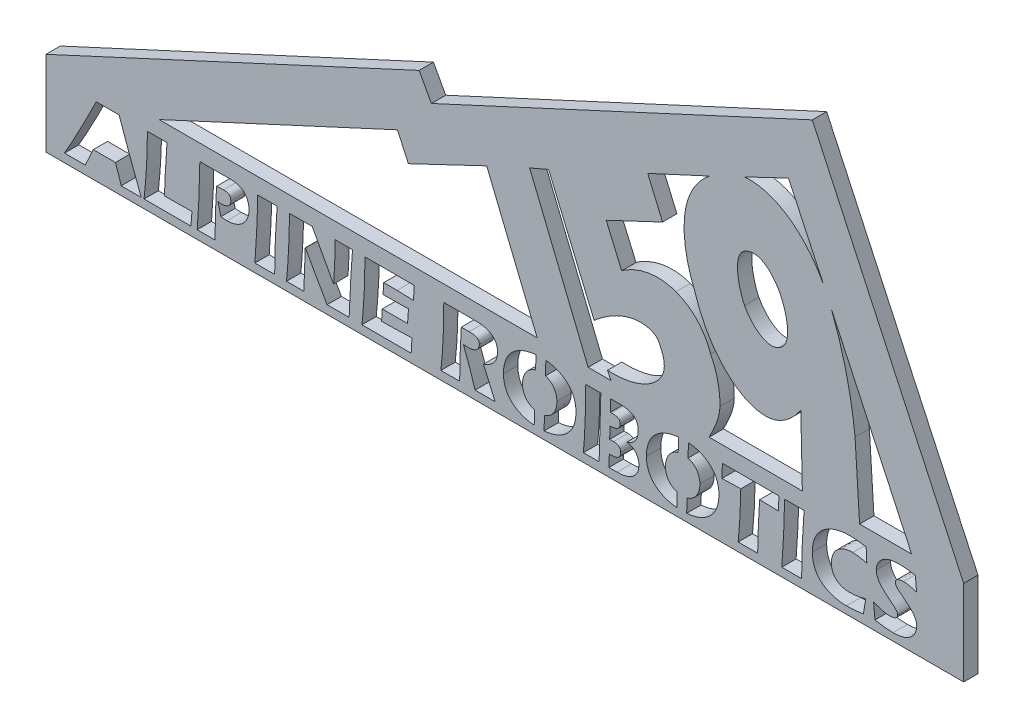
from build123d import *

# Parameters (mm, degrees)
BOSS_EXTRUDE1_DEPTH = 6.35


with BuildPart() as part:
    # Sketch3 → Boss-Extrude1 (new body)
    with BuildSketch(Plane.XY):
        Polygon((26.514269607, 145.890894888), (432.914269607, 145.890894888), (432.914269607, 183.703654156), (365.88058471, 327.965682502), (197.195058392, 249.908741462), (191.754304663, 259.874339463), (26.514269607, 183.43107077), align=None)
        with BuildLine():
            Line((48.791040319, 176.357545223), (58.878222756, 176.357545223))
            add(Edge.make_bspline(
                [(68.685368354, 149.635855201), (65.282867539, 158.489491339), (61.960225137, 167.383589074), (58.878222756, 176.357545223)],
                knots=[0, 0, 0, 0, 1, 1, 1, 1], degree=3))
            Line((68.685368354, 149.635855201), (59.798724072, 149.635855201))
            add(Edge.make_bspline(
                [(57.276795365, 157.327817614), (58.19782907, 154.763830143), (59.118330386, 152.240304268), (59.798724072, 149.635855201)],
                knots=[0, 0, 0, 0, 1, 1, 1, 1], degree=3))
            Line((57.276795365, 157.327817614), (47.429720559, 157.327817614))
            Line((47.429720559, 157.327817614), (43.907432123, 149.635855201))
            Line((43.907432123, 149.635855201), (34.700821796, 149.635855201))
            add(Edge.make_bspline(
                [(48.791040319, 176.357545223), (46.589077657, 171.670388725), (37.542716547, 154.323011699), (34.700821796, 149.635855201)],
                knots=[0, 0, 0, 0, 1, 1, 1, 1], degree=3))
        make_face(mode=Mode.SUBTRACT)
        with BuildLine():
            Line((91.147410587, 155.484685424), (90.707124532, 149.635855201))
            Line((90.707124532, 149.635855201), (69.932224388, 149.635855201))
            add(Edge.make_bspline(
                [(71.453260975, 176.357545223), (71.372870172, 167.424050671), (70.932584118, 158.489491339), (69.932224388, 149.635855201)],
                knots=[0, 0, 0, 0, 1, 1, 1, 1], degree=3))
            Line((71.453260975, 176.357545223), (80.099265238, 176.357545223))
            add(Edge.make_bspline(
                [(78.978585498, 155.364365414), (79.098905508, 161.655078861), (79.899086814, 173.673237742), (80.099265238, 176.357545223)],
                knots=[0, 0, 0, 0, 1, 1, 1, 1], degree=3))
            Line((78.978585498, 155.364365414), (83.461836847, 155.364365414))
            add(Edge.make_bspline(
                [(91.147410587, 155.484685424), (88.585552673, 155.364365414), (86.02369476, 155.364365414), (83.461836847, 155.364365414)],
                knots=[0, 0, 0, 0, 1, 1, 1, 1], degree=3))
        make_face(mode=Mode.SUBTRACT)
        with BuildLine():
            Line((94.634561321, 176.357545223), (108.804638258, 176.357545223))
            add(Edge.make_bspline(
                [(116.410353584, 168.745441223), (116.410353584, 171.189108684), (115.369532258, 176.357545223), (108.804638258, 176.357545223)],
                knots=[0, 0, 0, 0, 1, 1, 1, 1], degree=3))
            add(Edge.make_bspline(
                [(106.643137192, 159.651165065), (112.087351453, 159.651165065), (116.410353584, 163.056327827), (116.410353584, 168.745441223)],
                knots=[0, 0, 0, 0, 1, 1, 1, 1], degree=3))
            add(Edge.make_bspline(
                [(103.961491658, 159.891805085), (104.842063767, 159.732088257), (105.722635876, 159.651165065), (106.643137192, 159.651165065)],
                knots=[0, 0, 0, 0, 1, 1, 1, 1], degree=3))
            Line((103.961491658, 159.891805085), (102.680562701, 165.060241623))
            add(Edge.make_bspline(
                [(104.321386909, 164.899460017), (103.761313234, 164.899460017), (103.20070717, 164.979318431), (102.680562701, 165.060241623)],
                knots=[0, 0, 0, 0, 1, 1, 1, 1], degree=3))
            add(Edge.make_bspline(
                [(108.364352203, 168.184302769), (108.364352203, 165.781096905), (106.482887975, 164.899460017), (104.321386909, 164.899460017)],
                knots=[0, 0, 0, 0, 1, 1, 1, 1], degree=3))
            add(Edge.make_bspline(
                [(105.122100605, 170.748290241), (106.963635626, 170.748290241), (108.364352203, 170.347933393), (108.364352203, 168.184302769)],
                knots=[0, 0, 0, 0, 1, 1, 1, 1], degree=3))
            add(Edge.make_bspline(
                [(102.040098223, 170.588573413), (103.080919549, 170.668431827), (104.081279279, 170.748290241), (105.122100605, 170.748290241)],
                knots=[0, 0, 0, 0, 1, 1, 1, 1], degree=3))
            add(Edge.make_bspline(
                [(101.399633745, 149.635855201), (101.399633745, 159.651165065), (101.719599789, 164.458641573), (102.040098223, 170.588573413)],
                knots=[0, 0, 0, 0, 1, 1, 1, 1], degree=3))
            Line((101.399633745, 149.635855201), (93.473952374, 149.635855201))
            add(Edge.make_bspline(
                [(94.634561321, 176.357545223), (94.634561321, 168.66558281), (93.914238429, 153.682014831), (93.473952374, 149.635855201)],
                knots=[0, 0, 0, 0, 1, 1, 1, 1], degree=3))
        make_face(mode=Mode.SUBTRACT)
        with BuildLine():
            Line((120.177541156, 176.357545223), (128.864007015, 176.357545223))
            add(Edge.make_bspline(
                [(127.783256482, 149.635855201), (127.823185689, 158.529952936), (128.143151733, 167.463447488), (128.864007015, 176.357545223)],
                knots=[0, 0, 0, 0, 1, 1, 1, 1], degree=3))
            Line((127.783256482, 149.635855201), (119.016932209, 149.635855201))
            add(Edge.make_bspline(
                [(120.177541156, 176.357545223), (120.177541156, 165.460598471), (119.537076677, 157.527996038), (119.016932209, 149.635855201)],
                knots=[0, 0, 0, 0, 1, 1, 1, 1], degree=3))
        make_face(mode=Mode.SUBTRACT)
        with BuildLine():
            Line((154.605035716, 176.357545223), (162.25014786, 176.357545223))
            add(Edge.make_bspline(
                [(160.769572868, 149.635855201), (160.889360489, 156.64635915), (162.010040229, 173.632776145), (162.25014786, 176.357545223)],
                knots=[0, 0, 0, 0, 1, 1, 1, 1], degree=3))
            Line((160.769572868, 149.635855201), (151.002356477, 149.635855201))
            add(Edge.make_bspline(
                [(141.395389302, 166.622272196), (144.237284052, 160.973620397), (147.919821705, 155.445288607), (151.002356477, 149.635855201)],
                knots=[0, 0, 0, 0, 1, 1, 1, 1], degree=3))
            Line((141.395389302, 166.622272196), (141.314998498, 166.622272196))
            add(Edge.make_bspline(
                [(140.714995616, 149.635855201), (140.714995616, 153.641553235), (141.195210878, 164.219066332), (141.314998498, 166.622272196)],
                knots=[0, 0, 0, 0, 1, 1, 1, 1], degree=3))
            Line((140.714995616, 149.635855201), (133.029421876, 149.635855201))
            add(Edge.make_bspline(
                [(134.390209247, 176.357545223), (134.390209247, 168.66558281), (133.549566345, 153.882193255), (133.029421876, 149.635855201)],
                knots=[0, 0, 0, 0, 1, 1, 1, 1], degree=3))
            Line((134.390209247, 176.357545223), (144.397533269, 176.357545223))
            Line((144.397533269, 176.357545223), (153.844251227, 159.050629793))
            Line((153.844251227, 159.050629793), (153.924109641, 159.050629793))
            add(Edge.make_bspline(
                [(154.605035716, 176.357545223), (154.605035716, 171.670388725), (154.124288065, 161.614617264), (153.924109641, 159.050629793)],
                knots=[0, 0, 0, 0, 1, 1, 1, 1], degree=3))
        make_face(mode=Mode.SUBTRACT)
        with BuildLine():
            Line((167.781141596, 176.357545223), (189.55693386, 176.357545223))
            Line((189.55693386, 176.357545223), (189.276897022, 170.388394989))
            add(Edge.make_bspline(
                [(181.99168013, 170.629035009), (184.393288826, 170.629035009), (186.834826729, 170.508714999), (189.276897022, 170.388394989)],
                knots=[0, 0, 0, 0, 1, 1, 1, 1], degree=3))
            Line((181.99168013, 170.629035009), (176.067250608, 170.629035009))
            Line((176.067250608, 170.629035009), (175.786681381, 165.940813732))
            Line((175.786681381, 165.940813732), (180.350323532, 165.940813732))
            add(Edge.make_bspline(
                [(187.035005153, 166.061133742), (184.793645674, 165.981275329), (182.591683012, 165.940813732), (180.350323532, 165.940813732)],
                knots=[0, 0, 0, 0, 1, 1, 1, 1], degree=3))
            Line((187.035005153, 166.061133742), (186.634648306, 160.212303519))
            Line((186.634648306, 160.212303519), (175.426786129, 160.212303519))
            Line((175.426786129, 160.212303519), (175.146216902, 155.364365414))
            Line((175.146216902, 155.364365414), (177.788465619, 155.364365414))
            add(Edge.make_bspline(
                [(188.595970947, 155.684863848), (184.993824098, 155.484685424), (181.391144858, 155.364365414), (177.788465619, 155.364365414)],
                knots=[0, 0, 0, 0, 1, 1, 1, 1], degree=3))
            Line((188.595970947, 155.684863848), (188.236075696, 149.635855201))
            Line((188.236075696, 149.635855201), (166.420354226, 149.635855201))
            add(Edge.make_bspline(
                [(167.781141596, 176.357545223), (167.781141596, 163.457749454), (166.900569487, 154.042974861), (166.420354226, 149.635855201)],
                knots=[0, 0, 0, 0, 1, 1, 1, 1], degree=3))
        make_face(mode=Mode.SUBTRACT)
        with BuildLine():
            Line((202.679800798, 176.357545223), (216.851474903, 176.357545223))
            add(Edge.make_bspline(
                [(226.486126328, 169.266118081), (226.486126328, 176.157366799), (218.778192232, 176.357545223), (216.851474903, 176.357545223)],
                knots=[0, 0, 0, 0, 1, 1, 1, 1], degree=3))
            add(Edge.make_bspline(
                [(220.223629521, 161.453835658), (223.997205766, 162.77629099), (226.486126328, 165.060241623), (226.486126328, 169.266118081)],
                knots=[0, 0, 0, 0, 1, 1, 1, 1], degree=3))
            add(Edge.make_bspline(
                [(225.442643055, 149.635855201), (223.756565746, 153.602156417), (221.78938682, 157.448137624), (220.223629521, 161.453835658)],
                knots=[0, 0, 0, 0, 1, 1, 1, 1], degree=3))
            Line((225.442643055, 149.635855201), (216.52991169, 149.635855201))
            add(Edge.make_bspline(
                [(211.351359753, 164.619423179), (213.198218668, 159.651165065), (215.085006791, 154.723368547), (216.52991169, 149.635855201)],
                knots=[0, 0, 0, 0, 1, 1, 1, 1], degree=3))
            add(Edge.make_bspline(
                [(213.318538678, 164.419244756), (212.675944642, 164.419244756), (211.993421399, 164.499103169), (211.351359753, 164.619423179)],
                knots=[0, 0, 0, 0, 1, 1, 1, 1], degree=3))
            add(Edge.make_bspline(
                [(218.416699813, 168.065047538), (218.416699813, 165.299816865), (215.646677634, 164.419244756), (213.318538678, 164.419244756)],
                knots=[0, 0, 0, 0, 1, 1, 1, 1], degree=3))
            add(Edge.make_bspline(
                [(213.880741911, 170.748290241), (215.727068437, 170.748290241), (218.416699813, 170.748290241), (218.416699813, 168.065047538)],
                knots=[0, 0, 0, 0, 1, 1, 1, 1], degree=3))
            Line((213.880741911, 170.748290241), (210.42819649, 170.748290241))
            add(Edge.make_bspline(
                [(209.705211651, 149.635855201), (209.785602454, 156.686820746), (209.986313267, 163.737786291), (210.42819649, 170.748290241)],
                knots=[0, 0, 0, 0, 1, 1, 1, 1], degree=3))
            Line((209.705211651, 149.635855201), (201.395145115, 149.635855201))
            add(Edge.make_bspline(
                [(202.679800798, 176.357545223), (202.639871591, 165.660776895), (202.318840767, 157.928352885), (201.395145115, 149.635855201)],
                knots=[0, 0, 0, 0, 1, 1, 1, 1], degree=3))
        make_face(mode=Mode.SUBTRACT)
        Polygon((221.673059731, 238.220331281), (244.068486736, 183.43107077), (227.52814553, 183.43107077), (204.565723787, 183.43107077), (76.560605827, 183.43107077), (182.148468815, 232.278000164), (186.996816999, 221.713507692), align=None, mode=Mode.SUBTRACT)
        with BuildLine():
            Line((243.507681026, 176.724627731), (243.336517826, 170.716280326))
            add(Edge.make_bspline(
                [(237.529480172, 162.496254152), (237.529480172, 166.487444574), (239.710613098, 169.784066443), (243.336517826, 170.716280326)],
                knots=[0, 0, 0, 0, 1, 1, 1, 1], degree=3))
            add(Edge.make_bspline(
                [(242.896631063, 155.273326823), (239.65610973, 156.106116981), (237.529480172, 158.84386305), (237.529480172, 162.496254152)],
                knots=[0, 0, 0, 0, 1, 1, 1, 1], degree=3))
            Line((242.896631063, 155.273326823), (242.725334766, 149.258258001))
            add(Edge.make_bspline(
                [(229.098561237, 162.215152536), (229.098561237, 153.885853432), (235.378626895, 149.898056993), (242.725334766, 149.258258001)],
                knots=[0, 0, 0, 0, 1, 1, 1, 1], degree=3))
            add(Edge.make_bspline(
                [(243.507681026, 176.724627731), (236.383844678, 176.074180951), (229.098561237, 172.213159744), (229.098561237, 162.215152536)],
                knots=[0, 0, 0, 0, 1, 1, 1, 1], degree=3))
        make_face(mode=Mode.SUBTRACT)
        with BuildLine():
            Line((247.698317836, 170.683937669), (247.870479267, 176.727822068))
            add(Edge.make_bspline(
                [(261.214420913, 163.617466281), (261.214420913, 171.773472627), (255.155296867, 176.043502011), (247.870479267, 176.727822068)],
                knots=[0, 0, 0, 0, 1, 1, 1, 1], degree=3))
            add(Edge.make_bspline(
                [(247.088199555, 149.263914639), (255.128211555, 149.98277346), (261.214420913, 154.687166066), (261.214420913, 163.617466281)],
                knots=[0, 0, 0, 0, 1, 1, 1, 1], degree=3))
            Line((247.088199555, 149.263914639), (247.260560632, 155.3147201))
            add(Edge.make_bspline(
                [(252.784566757, 163.417287858), (252.784566757, 159.605512672), (250.73693048, 156.304897882), (247.260560632, 155.3147201)],
                knots=[0, 0, 0, 0, 1, 1, 1, 1], degree=3))
            add(Edge.make_bspline(
                [(247.698317836, 170.683937669), (250.836154559, 169.785197771), (252.784566757, 166.9669278), (252.784566757, 163.417287858)],
                knots=[0, 0, 0, 0, 1, 1, 1, 1], degree=3))
        make_face(mode=Mode.SUBTRACT)
        with BuildLine():
            Line((272.230889091, 176.357545223), (271.46977186, 149.635855201))
            Line((271.46977186, 149.635855201), (264.470514637, 149.635855201))
            add(Edge.make_bspline(
                [(265.554459506, 176.357545223), (265.594921103, 168.66558281), (265.073179466, 153.922654851), (264.470514637, 149.635855201)],
                knots=[0, 0, 0, 0, 1, 1, 1, 1], degree=3))
            Line((265.554459506, 176.357545223), (272.230889091, 176.357545223))
        make_face(mode=Mode.SUBTRACT)
        with BuildLine():
            Line((275.832437003, 149.635855201), (275.981971883, 154.884150153))
            Line((275.981971883, 154.884150153), (276.554689807, 154.884150153))
            add(Edge.make_bspline(
                [(281.010789294, 157.928352885), (281.010789294, 155.16418699), (278.722579546, 154.884150153), (276.554689807, 154.884150153)],
                knots=[0, 0, 0, 0, 1, 1, 1, 1], degree=3))
            add(Edge.make_bspline(
                [(277.879274696, 160.573263549), (280.167484445, 160.573263549), (281.010789294, 159.410525045), (281.010789294, 157.928352885)],
                knots=[0, 0, 0, 0, 1, 1, 1, 1], degree=3))
            Line((277.879274696, 160.573263549), (276.144017914, 160.573263549))
            Line((276.144017914, 160.573263549), (276.293486245, 165.820493722))
            Line((276.293486245, 165.820493722), (276.3939082, 165.820493722))
            add(Edge.make_bspline(
                [(280.729687678, 168.745441223), (280.729687678, 166.783053803), (279.484961202, 165.820493722), (276.3939082, 165.820493722)],
                knots=[0, 0, 0, 0, 1, 1, 1, 1], degree=3))
            add(Edge.make_bspline(
                [(276.956111433, 171.109250271), (278.682117949, 171.109250271), (280.729687678, 170.948468664), (280.729687678, 168.745441223)],
                knots=[0, 0, 0, 0, 1, 1, 1, 1], degree=3))
            Line((276.956111433, 171.109250271), (276.444085904, 171.109250271))
            Line((276.444085904, 171.109250271), (276.593554235, 176.357545223))
            Line((276.593554235, 176.357545223), (280.970327698, 176.357545223))
            add(Edge.make_bspline(
                [(288.798581804, 170.147754969), (288.798581804, 174.714591457), (285.546747196, 176.357545223), (280.970327698, 176.357545223)],
                knots=[0, 0, 0, 0, 1, 1, 1, 1], degree=3))
            add(Edge.make_bspline(
                [(283.82074068, 163.376826261), (287.032113692, 164.219066332), (288.798581804, 166.662733793), (288.798581804, 170.147754969)],
                knots=[0, 0, 0, 0, 1, 1, 1, 1], degree=3))
            Line((283.82074068, 163.376826261), (283.82074068, 163.296967848))
            add(Edge.make_bspline(
                [(289.07968342, 157.168100786), (289.07968342, 160.492340356), (286.952255278, 162.937072596), (283.82074068, 163.296967848)],
                knots=[0, 0, 0, 0, 1, 1, 1, 1], degree=3))
            add(Edge.make_bspline(
                [(279.444499606, 149.635855201), (285.466888782, 149.635855201), (289.07968342, 152.359559499), (289.07968342, 157.168100786)],
                knots=[0, 0, 0, 0, 1, 1, 1, 1], degree=3))
            Line((279.444499606, 149.635855201), (275.832437003, 149.635855201))
        make_face(mode=Mode.SUBTRACT)
        with BuildLine():
            Line((306.664639227, 176.710319766), (306.492677443, 170.674687402))
            add(Edge.make_bspline(
                [(300.846554493, 162.496254152), (300.846554493, 166.428349348), (302.962935555, 169.687371214), (306.492677443, 170.674687402)],
                knots=[0, 0, 0, 0, 1, 1, 1, 1], degree=3))
            add(Edge.make_bspline(
                [(306.055053336, 155.31019479), (302.902509355, 156.189901767), (300.846554493, 158.902758631), (300.846554493, 162.496254152)],
                knots=[0, 0, 0, 0, 1, 1, 1, 1], degree=3))
            Line((306.055053336, 155.31019479), (305.883091551, 149.273098356))
            add(Edge.make_bspline(
                [(292.415635558, 162.215152536), (292.415635558, 153.946213083), (298.605261562, 149.956686378), (305.883091551, 149.273098356)],
                knots=[0, 0, 0, 0, 1, 1, 1, 1], degree=3))
            add(Edge.make_bspline(
                [(306.664639227, 176.710319766), (299.59211191, 176.016682893), (292.415635558, 172.138225932), (292.415635558, 162.215152536)],
                knots=[0, 0, 0, 0, 1, 1, 1, 1], degree=3))
        make_face(mode=Mode.SUBTRACT)
        with BuildLine():
            Line((310.856806657, 170.723001743), (311.028302601, 176.743993397))
            add(Edge.make_bspline(
                [(324.531495234, 163.617466281), (324.531495234, 171.833100243), (318.384194189, 176.107654936), (311.028302601, 176.743993397)],
                knots=[0, 0, 0, 0, 1, 1, 1, 1], degree=3))
            add(Edge.make_bspline(
                [(310.245091208, 149.247543664), (318.365094719, 149.917422658), (324.531495234, 154.627471901), (324.531495234, 163.617466281)],
                knots=[0, 0, 0, 0, 1, 1, 1, 1], degree=3))
            Line((310.245091208, 149.247543664), (310.4166537, 155.271663106))
            add(Edge.make_bspline(
                [(316.101641078, 163.417287858), (316.101641078, 159.54721603), (313.990583911, 156.204475927), (310.4166537, 155.271663106)],
                knots=[0, 0, 0, 0, 1, 1, 1, 1], degree=3))
            add(Edge.make_bspline(
                [(310.856806657, 170.723001743), (314.086147812, 169.874239902), (316.101641078, 167.025490637), (316.101641078, 163.417287858)],
                knots=[0, 0, 0, 0, 1, 1, 1, 1], degree=3))
        make_face(mode=Mode.SUBTRACT)
        with BuildLine():
            Line((326.062647221, 176.357545223), (351.113699227, 176.357545223))
            Line((351.113699227, 176.357545223), (350.871994428, 170.427791807))
            add(Edge.make_bspline(
                [(342.562460282, 170.629035009), (345.653513284, 170.629035009), (350.551495994, 170.468253403), (350.871994428, 170.427791807)],
                knots=[0, 0, 0, 0, 1, 1, 1, 1], degree=3))
            add(Edge.make_bspline(
                [(341.678693836, 149.635855201), (341.719155433, 154.643510133), (342.080115463, 164.258463149), (342.562460282, 170.629035009)],
                knots=[0, 0, 0, 0, 1, 1, 1, 1], degree=3))
            Line((341.678693836, 149.635855201), (333.047596478, 149.635855201))
            add(Edge.make_bspline(
                [(334.21246454, 170.629035009), (334.131541347, 162.53565097), (333.689658124, 156.045823878), (333.047596478, 149.635855201)],
                knots=[0, 0, 0, 0, 1, 1, 1, 1], degree=3))
            add(Edge.make_bspline(
                [(325.861404018, 170.427791807), (328.672420182, 170.508714999), (331.441909972, 170.629035009), (334.21246454, 170.629035009)],
                knots=[0, 0, 0, 0, 1, 1, 1, 1], degree=3))
            Line((325.861404018, 170.427791807), (326.062647221, 176.357545223))
        make_face(mode=Mode.SUBTRACT)
        with BuildLine():
            Line((353.524358544, 176.357545223), (362.236379095, 176.357545223))
            add(Edge.make_bspline(
                [(361.152434226, 149.635855201), (361.192895822, 158.529952936), (361.513394256, 167.463447488), (362.236379095, 176.357545223)],
                knots=[0, 0, 0, 0, 1, 1, 1, 1], degree=3))
            Line((361.152434226, 149.635855201), (352.360555261, 149.635855201))
            add(Edge.make_bspline(
                [(353.524358544, 176.357545223), (353.524358544, 165.460598471), (352.882296897, 157.527996038), (352.360555261, 149.635855201)],
                knots=[0, 0, 0, 0, 1, 1, 1, 1], degree=3))
        make_face(mode=Mode.SUBTRACT)
        with BuildLine():
            Line((389.737487235, 176.116905203), (390.018588852, 170.027434959))
            add(Edge.make_bspline(
                [(383.755559656, 170.988930261), (385.882987798, 170.988930261), (387.971019123, 170.508714999), (390.018588852, 170.027434959)],
                knots=[0, 0, 0, 0, 1, 1, 1, 1], degree=3))
            add(Edge.make_bspline(
                [(374.321619044, 162.335472546), (374.321619044, 166.342235359), (376.970788823, 170.988930261), (383.755559656, 170.988930261)],
                knots=[0, 0, 0, 0, 1, 1, 1, 1], degree=3))
            add(Edge.make_bspline(
                [(382.39051317, 155.004470163), (377.814093672, 155.004470163), (374.321619044, 157.448137624), (374.321619044, 162.335472546)],
                knots=[0, 0, 0, 0, 1, 1, 1, 1], degree=3))
            add(Edge.make_bspline(
                [(389.536244033, 156.086285475), (387.207572688, 155.484685424), (384.839504525, 155.004470163), (382.39051317, 155.004470163)],
                knots=[0, 0, 0, 0, 1, 1, 1, 1], degree=3))
            Line((389.536244033, 156.086285475), (388.49276076, 149.756175211))
            add(Edge.make_bspline(
                [(381.025466684, 149.154575161), (383.514919636, 149.154575161), (386.043769405, 149.395215181), (388.49276076, 149.756175211)],
                knots=[0, 0, 0, 0, 1, 1, 1, 1], degree=3))
            add(Edge.make_bspline(
                [(365.890700109, 162.255614132), (365.890700109, 151.799485824), (374.72304067, 149.154575161), (381.025466684, 149.154575161)],
                knots=[0, 0, 0, 0, 1, 1, 1, 1], degree=3))
            add(Edge.make_bspline(
                [(382.551294776, 176.837760484), (373.518775791, 176.837760484), (365.890700109, 171.990887159), (365.890700109, 162.255614132)],
                knots=[0, 0, 0, 0, 1, 1, 1, 1], degree=3))
            add(Edge.make_bspline(
                [(389.737487235, 176.116905203), (387.368354294, 176.51726205), (384.959824535, 176.837760484), (382.551294776, 176.837760484)],
                knots=[0, 0, 0, 0, 1, 1, 1, 1], degree=3))
        make_face(mode=Mode.SUBTRACT)
        with BuildLine():
            Line((411.53989897, 176.076443606), (412.061640607, 169.786794939))
            add(Edge.make_bspline(
                [(406.240494633, 171.109250271), (408.208205948, 171.109250271), (410.254710898, 170.508714999), (412.061640607, 169.786794939)],
                knots=[0, 0, 0, 0, 1, 1, 1, 1], degree=3))
            add(Edge.make_bspline(
                [(402.627699995, 168.986081244), (402.627699995, 170.668431827), (404.995768157, 171.109250271), (406.240494633, 171.109250271)],
                knots=[0, 0, 0, 0, 1, 1, 1, 1], degree=3))
            add(Edge.make_bspline(
                [(412.14149902, 156.927460766), (412.14149902, 162.856149404), (402.627699995, 165.820493722), (402.627699995, 168.986081244)],
                knots=[0, 0, 0, 0, 1, 1, 1, 1], degree=3))
            add(Edge.make_bspline(
                [(401.623613539, 149.154575161), (410.215314081, 149.154575161), (412.14149902, 154.202691689), (412.14149902, 156.927460766)],
                knots=[0, 0, 0, 0, 1, 1, 1, 1], degree=3))
            add(Edge.make_bspline(
                [(393.634577827, 150.036212048), (396.244350788, 149.555996787), (398.933982164, 149.154575161), (401.623613539, 149.154575161)],
                knots=[0, 0, 0, 0, 1, 1, 1, 1], degree=3))
            Line((393.634577827, 150.036212048), (393.032977777, 156.64635915))
            add(Edge.make_bspline(
                [(399.938068619, 154.884150153), (397.609397274, 154.884150153), (395.119944323, 155.725325445), (393.032977777, 156.64635915)],
                knots=[0, 0, 0, 0, 1, 1, 1, 1], degree=3))
            add(Edge.make_bspline(
                [(403.711644864, 156.966857584), (403.711644864, 155.124790173), (401.262653509, 154.884150153), (399.938068619, 154.884150153)],
                knots=[0, 0, 0, 0, 1, 1, 1, 1], degree=3))
            add(Edge.make_bspline(
                [(394.19678106, 169.506758101), (394.19678106, 163.256506251), (403.711644864, 160.051521912), (403.711644864, 156.966857584)],
                knots=[0, 0, 0, 0, 1, 1, 1, 1], degree=3))
            add(Edge.make_bspline(
                [(404.394168107, 176.837760484), (395.280725929, 176.837760484), (394.19678106, 171.349890291), (394.19678106, 169.506758101)],
                knots=[0, 0, 0, 0, 1, 1, 1, 1], degree=3))
            add(Edge.make_bspline(
                [(411.53989897, 176.076443606), (409.211227625, 176.51726205), (406.802697866, 176.837760484), (404.394168107, 176.837760484)],
                knots=[0, 0, 0, 0, 1, 1, 1, 1], degree=3))
        make_face(mode=Mode.SUBTRACT)
        with BuildLine():
            Line((266.594814992, 183.43107077), (240.699393357, 246.932085637))
            Line((240.699393357, 246.932085637), (249.094908396, 250.573828951))
            add(Edge.make_bspline(
                [(269.255231497, 202.740901765), (262.527825625, 218.681572833), (255.811400285, 234.633157883), (249.094908396, 250.573828951)],
                knots=[0, 0, 0, 0, 1, 1, 1, 1], degree=3))
            add(Edge.make_bspline(
                [(295.946575322, 210.885661384), (288.946652613, 214.581908065), (278.512152625, 210.831158017), (269.255231497, 202.740901765)],
                knots=[0, 0, 0, 0, 1, 1, 1, 1], degree=3))
            add(Edge.make_bspline(
                [(298.890489197, 206.676989882), (298.094500457, 208.857656967), (297.069584266, 210.285991246), (295.946575322, 210.885661384)],
                knots=[0, 0, 0, 0, 1, 1, 1, 1], degree=3))
            add(Edge.make_bspline(
                [(300.078915491, 198.663064964), (300.416916227, 200.08048526), (300.722241562, 202.828147082), (298.890489197, 206.676989882)],
                knots=[0, 0, 0, 0, 1, 1, 1, 1], degree=3))
            add(Edge.make_bspline(
                [(275.153906681, 186.54940873), (288.434161243, 185.829817873), (298.38891181, 191.554068971), (300.078915491, 198.663064964)],
                knots=[0, 0, 0, 0, 1, 1, 1, 1], degree=3))
            Line((275.153906681, 186.54940873), (276.756731594, 183.43107077))
            Line((276.756731594, 183.43107077), (266.594814992, 183.43107077))
        make_face(mode=Mode.SUBTRACT)
        with BuildLine():
            Line((361.475594607, 183.43107077), (320.162907259, 183.43107077))
            add(Edge.make_bspline(
                [(324.9712489, 197.572731422), (324.884003583, 192.949727849), (322.64883313, 188.250326394), (320.162907259, 183.43107077)],
                knots=[0, 0, 0, 0, 1, 1, 1, 1], degree=3))
            add(Edge.make_bspline(
                [(320.849756166, 215.55232089), (322.365335761, 212.804659067), (325.145672985, 206.284485778), (324.9712489, 197.572731422)],
                knots=[0, 0, 0, 0, 1, 1, 1, 1], degree=3))
            add(Edge.make_bspline(
                [(305.508821785, 231.863668094), (316.946409998, 227.709499959), (320.479080028, 216.773489133), (320.849756166, 215.55232089)],
                knots=[0, 0, 0, 0, 1, 1, 1, 1], degree=3))
            add(Edge.make_bspline(
                [(281.466913934, 227.894904577), (282.110240006, 228.407329398), (292.784581429, 236.486738215), (305.508821785, 231.863668094)],
                knots=[0, 0, 0, 0, 1, 1, 1, 1], degree=3))
            Line((281.466913934, 227.894904577), (274.597825926, 243.824661661))
            Line((274.597825926, 243.824661661), (299.577404652, 255.622078576))
            Line((299.577404652, 255.622078576), (292.991747464, 270.995754906))
            Line((292.991747464, 270.995754906), (318.79999033, 282.934920506))
            Line((318.79999033, 282.934920506), (320.424576661, 283.709081279))
            add(Edge.make_bspline(
                [(315.637996438, 278.955176457), (316.750157947, 280.361749318), (318.309326927, 282.040839016), (320.424576661, 283.709081279)],
                knots=[0, 0, 0, 0, 1, 1, 1, 1], degree=3))
            add(Edge.make_bspline(
                [(313.577250071, 236.933745686), (313.021169316, 238.165827913), (302.510404544, 262.458491183), (315.637996438, 278.955176457)],
                knots=[0, 0, 0, 0, 1, 1, 1, 1], degree=3))
            add(Edge.make_bspline(
                [(347.890081258, 204.289156762), (336.04900841, 202.075814276), (320.424576661, 214.516490714), (313.577250071, 236.933745686)],
                knots=[0, 0, 0, 0, 1, 1, 1, 1], degree=3))
            add(Edge.make_bspline(
                [(360.788679151, 214.036741294), (355.435170739, 206.175412495), (349.950761077, 204.681660866), (347.890081258, 204.289156762)],
                knots=[0, 0, 0, 0, 1, 1, 1, 1], degree=3))
            Line((360.788679151, 214.036741294), (361.475594607, 183.43107077))
        make_face(mode=Mode.SUBTRACT)
        with BuildLine():
            Line((374.308841698, 259.699915378), (409.87551653, 183.43107077))
            Line((409.87551653, 183.43107077), (386.82584947, 183.43107077))
            add(Edge.make_bspline(
                [(384.808759036, 215.824904275), (385.484760508, 205.019661602), (386.149847997, 194.22539946), (386.82584947, 183.43107077)],
                knots=[0, 0, 0, 0, 1, 1, 1, 1], degree=3))
            add(Edge.make_bspline(
                [(377.72159101, 250.017748196), (381.712182494, 237.489826441), (383.783842844, 225.877747594), (384.808759036, 215.824904275)],
                knots=[0, 0, 0, 0, 1, 1, 1, 1], degree=3))
            add(Edge.make_bspline(
                [(374.308841698, 259.699915378), (375.508181975, 256.625166802), (376.653085433, 253.397755559), (377.72159101, 250.017748196)],
                knots=[0, 0, 0, 0, 1, 1, 1, 1], degree=3))
        make_face(mode=Mode.SUBTRACT)
        with BuildLine():
            add(Edge.make_bspline(
                [(351.047749487, 255.279485981), (348.989066129, 258.779214416), (343.375818226, 266.372085847), (336.362585781, 262.896581132)],
                knots=[0, 0, 0, 0, 1, 1, 1, 1], degree=3))
            add(Edge.make_bspline(
                [(351.047749487, 233.183062187), (358.83434412, 237.430265374), (352.96168947, 252.02578801), (351.047749487, 255.279485981)],
                knots=[0, 0, 0, 0, 1, 1, 1, 1], degree=3))
            add(Edge.make_bspline(
                [(335.86273866, 241.760854055), (338.352590903, 236.928288695), (345.008989336, 229.889235363), (351.047749487, 233.183062187)],
                knots=[0, 0, 0, 0, 1, 1, 1, 1], degree=3))
            add(Edge.make_bspline(
                [(336.362585781, 262.896581132), (329.912088959, 259.699915378), (333.640279005, 246.074406274), (335.86273866, 241.760854055)],
                knots=[0, 0, 0, 0, 1, 1, 1, 1], degree=3))
        make_face(mode=Mode.SUBTRACT)
        with BuildLine():
            Line((335.86273866, 291.079280833), (355.347925422, 300.369343203))
            Line((355.347925422, 300.369343203), (370.810976626, 267.357006283))
            add(Edge.make_bspline(
                [(335.86273866, 291.079280833), (348.371494396, 292.232635974), (361.95873801, 283.709081279), (370.810976626, 267.357006283)],
                knots=[0, 0, 0, 0, 1, 1, 1, 1], degree=3))
        make_face(mode=Mode.SUBTRACT)
    extrude(amount=BOSS_EXTRUDE1_DEPTH)


solid = part.part
